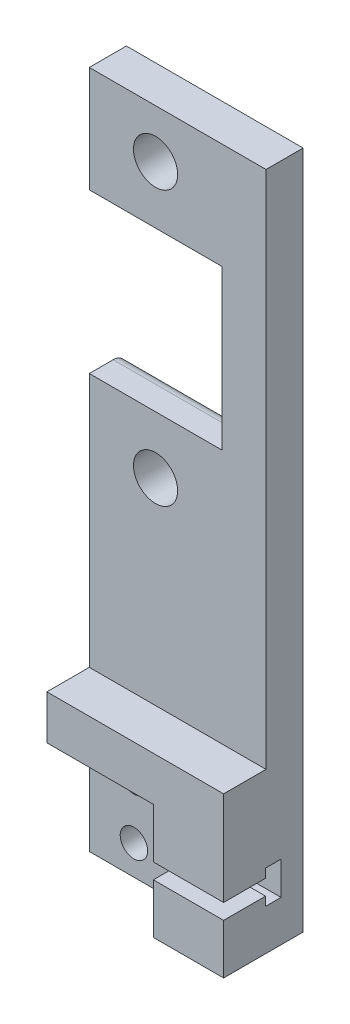
from build123d import *

# Parameters (mm, degrees)
PROFILESKETCH3_R                           = 2.5
PROFILEBOSS_EXTRUDE1_DEPTH                 = 9
MICROSWITCHCUTSKETCH4_W                    = 12.05
MICROSWITCHCUTSKETCH4_H                    = 13.05
MICROSWITCHCUT_EXTRUDE1_DEPTH              = 4.8
SKETCH5_R                                  = 1.55
MICROSWITCHMOUNTINGHOLESCUT_EXTRUDE2_DEPTH = 3.1
SMALLCHANNELCABLESKETCH6_W                 = 7.95
SMALLCHANNELCABLESKETCH6_H                 = 1.75
SMALLCHANNELCABLECUT_EXTRUDE3_DEPTH        = 4.75
LARGECHANNELCABLESKETCH7_W                 = 7.95
LARGECHANNELCABLESKETCH7_H                 = 3.75
LARGECHANNELCABLECUT_EXTRUDE4_DEPTH        = 1.75
CHAMFER1_SIZE                              = 1
SKETCH7_W                                  = 4.8
SKETCH7_H                                  = 58.8
BOLTSPACECUT_EXTRUDE1_DEPTH                = 80.918223829
FILLET1_R                                  = 1.5


with BuildPart() as part:
    # ProfileSketch3 → ProfileBoss-Extrude1 (new body)
    with BuildSketch(Plane.XY):
        Polygon((0, 46.85), (15, 46.85), (15, 64.85), (0, 64.85), (0, 76.85), (20, 76.85), (20, 0), (0, 0), align=None)
        with Locations((7.5, 40.35)):
            Circle(PROFILESKETCH3_R, mode=Mode.SUBTRACT)
        with Locations((7.5, 71.35)):
            Circle(PROFILESKETCH3_R, mode=Mode.SUBTRACT)
    extrude(amount=PROFILEBOSS_EXTRUDE1_DEPTH)

    # MicroSwitchCutSketch4 → MicroSwitchCut-Extrude1 (cut)
    with BuildSketch(Plane.XY.offset(9)):
        with Locations((6.025, 6.525)):
            Rectangle(MICROSWITCHCUTSKETCH4_W, MICROSWITCHCUTSKETCH4_H)
    extrude(amount=-MICROSWITCHCUT_EXTRUDE1_DEPTH, mode=Mode.SUBTRACT)

    # Sketch5 → MicroSwitchMountingHolesCut-Extrude2 (cut)
    with BuildSketch(Plane.XY.offset(4.2)):
        with Locations((5.05, 9.7)):
            Circle(SKETCH5_R)
        with Locations((5.05, 3.35)):
            Circle(SKETCH5_R)
    extrude(amount=-MICROSWITCHMOUNTINGHOLESCUT_EXTRUDE2_DEPTH, mode=Mode.SUBTRACT)

    # SmallChannelCableSketch6 → SmallChannelCableCut-Extrude3 (cut)
    with BuildSketch(Plane.XY.offset(9)):
        with Locations((16.025, 6.525)):
            Rectangle(SMALLCHANNELCABLESKETCH6_W, SMALLCHANNELCABLESKETCH6_H)
    extrude(amount=-SMALLCHANNELCABLECUT_EXTRUDE3_DEPTH, mode=Mode.SUBTRACT)

    # LargeChannelCableSketch7 → LargeChannelCableCut-Extrude4 (cut)
    with BuildSketch(Plane.XY.offset(4.25)):
        with Locations((16.025, 6.525)):
            Rectangle(LARGECHANNELCABLESKETCH7_W, LARGECHANNELCABLESKETCH7_H)
    extrude(amount=-LARGECHANNELCABLECUT_EXTRUDE4_DEPTH, mode=Mode.SUBTRACT)

    # Chamfer1
    chamfer1_edges = [part.edges().sort_by_distance(p)[0] for p in [
        (12.05, 6.525, 4.2),
    ]]
    chamfer(chamfer1_edges, length=CHAMFER1_SIZE)

    # Sketch7 → BoltSpaceCut-Extrude1 (cut, through all)
    with BuildSketch(Plane.ZY):
        with Locations((6.6, 47.45)):
            Rectangle(SKETCH7_W, SKETCH7_H)
    extrude(amount=-BOLTSPACECUT_EXTRUDE1_DEPTH, mode=Mode.SUBTRACT)

    # Fillet1
    fillet1_edges = [part.edges().sort_by_distance(p)[0] for p in [
        (7.5, 46.85, 0),
        (7.5, 64.85, 0),
    ]]
    fillet(fillet1_edges, radius=FILLET1_R)


solid = part.part
